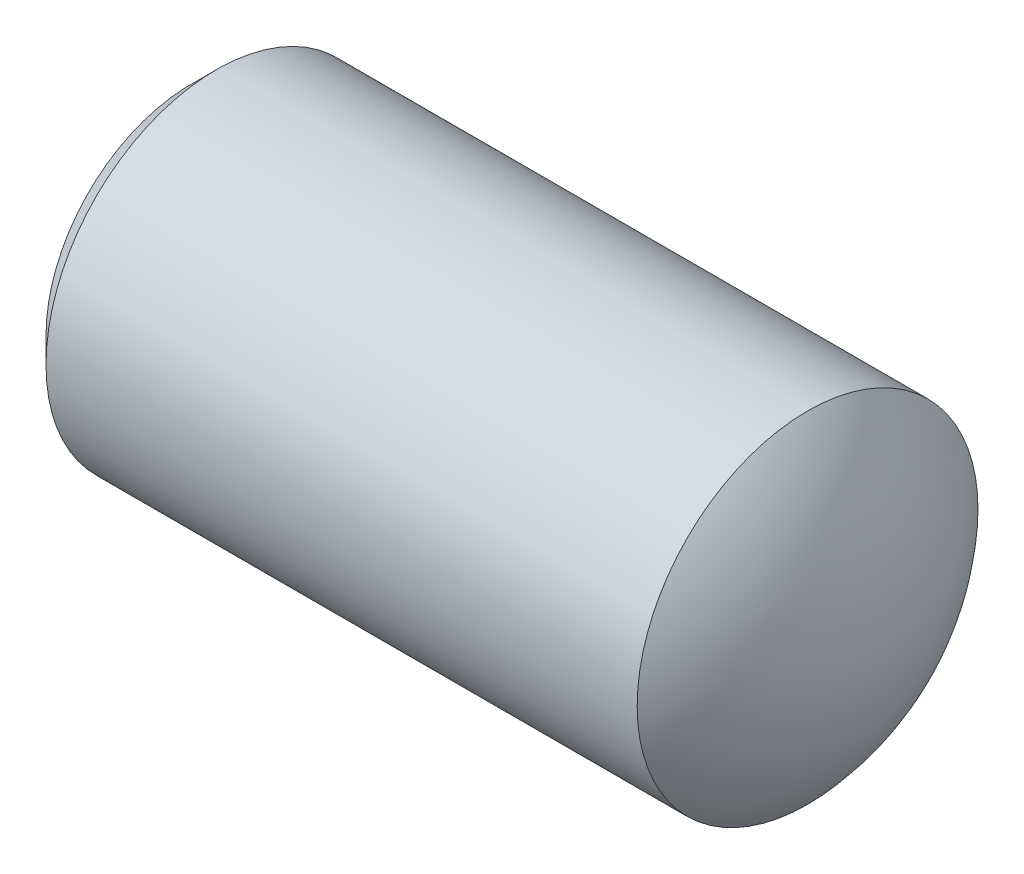
from build123d import *

# Parameters (mm, degrees)
HEX_2_DEPTH = 14.2748


with BuildPart() as part:
    # BodySke → BaseBody (revolve)
    with BuildSketch(Plane.XY):
        with BuildLine():
            Line((0, 0), (0, 10.81024))
            Line((0, 10.81024), (1.88976, 12.7))
            Line((1.88976, 12.7), (45.949031657, 12.7))
            ThreePointArc((45.949031657, 12.7), (49.545983438, 6.79746081), (50.8, 0))
            Line((50.8, 0), (0, 0))
        make_face()
    revolve(axis=Axis((-12.7, 0, 0), (1, 0, 0)))

    # Sketch2 → Hex 2 (cut)
    with BuildSketch(Plane.ZY):
        Polygon((4.120779811, 7.1374), (-4.120779811, 7.1374), (-8.241559623, 0), (-4.120779811, -7.1374), (4.120779811, -7.1374), (8.241559623, 0), align=None)
    extrude(amount=-HEX_2_DEPTH, mode=Mode.SUBTRACT)


solid = part.part
